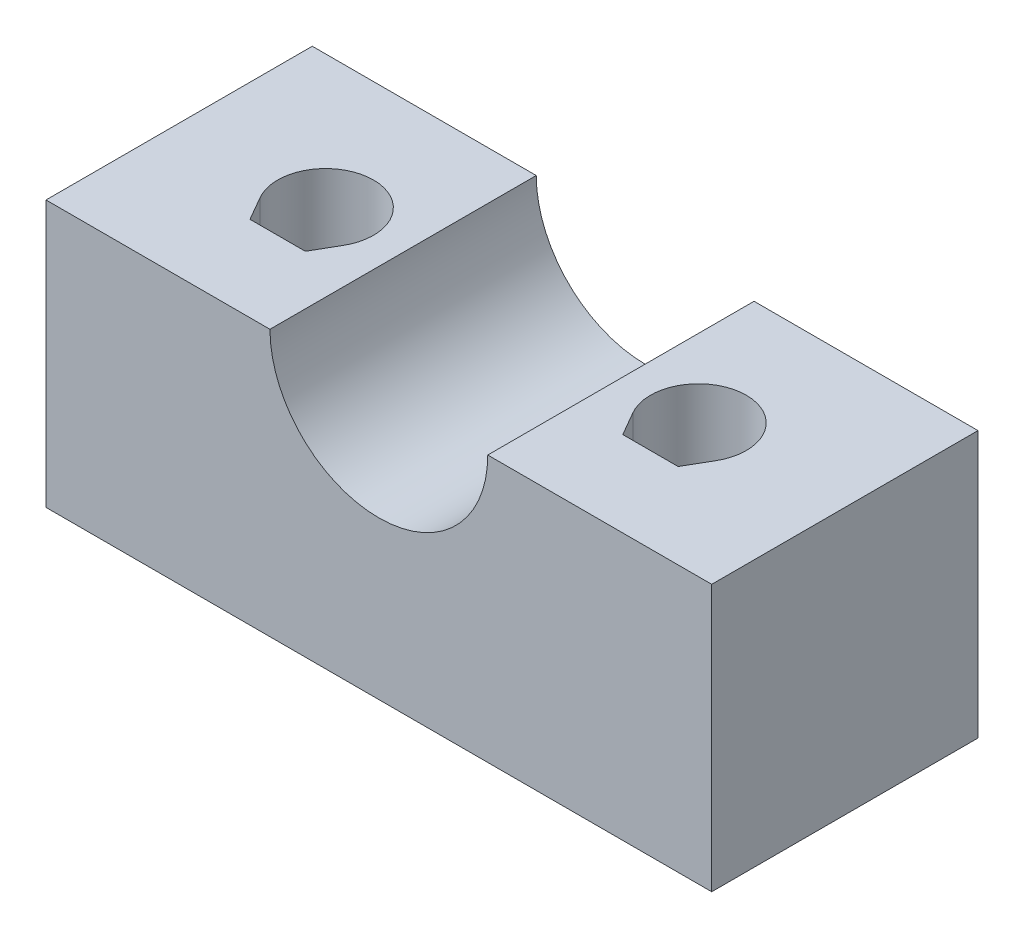
from build123d import *

# Parameters (mm, degrees)
MAIN_BODY_DEPTH   = 5
SCREW_HOLES_REACH = 18.771


with BuildPart() as part:
    # Schizzo1 → Main body (new, symmetric)
    with BuildSketch(Plane.XY):
        with BuildLine():
            Line((-12.5, -5), (12.5, -5))
            Line((12.5, -5), (12.5, 5))
            Line((12.5, 5), (4.09, 5))
            ThreePointArc((4.09, 5), (0, 0.91), (-4.09, 5))
            Line((-4.09, 5), (-12.5, 5))
            Line((-12.5, 5), (-12.5, -5))
        make_face()
    extrude(amount=MAIN_BODY_DEPTH, both=True)

    # Schizzo2 → screw holes (cut, up to next)
    with BuildSketch(Plane.XZ.offset(5), mode=Mode.PRIVATE) as screw_holes_sk1:
        with BuildLine():
            Line((-5.960769515, 1.8), (-5.441154273, 0.9))
            ThreePointArc((-5.441154273, 0.9), (-7, -1.8), (-8.558845727, 0.9))
            Line((-8.558845727, 0.9), (-8.039230485, 1.8))
            Line((-8.039230485, 1.8), (-5.960769515, 1.8))
        make_face()
    screw_holes_tool1 = extrude(screw_holes_sk1.sketch, amount=-SCREW_HOLES_REACH, mode=Mode.PRIVATE) & part.part
    # Schizzo2 → screw holes (cut, up to next)
    with BuildSketch(Plane.XZ.offset(5), mode=Mode.PRIVATE) as screw_holes_sk2:
        with BuildLine():
            Line((5.960769515, 1.8), (8.039230485, 1.8))
            Line((8.039230485, 1.8), (8.558845727, 0.9))
            ThreePointArc((8.558845727, 0.9), (7, -1.8), (5.441154273, 0.9))
            Line((5.441154273, 0.9), (5.960769515, 1.8))
        make_face()
    screw_holes_tool2 = extrude(screw_holes_sk2.sketch, amount=-SCREW_HOLES_REACH, mode=Mode.PRIVATE) & part.part
    add(screw_holes_tool1.solids().sort_by_distance((-7, -5, 0.053309))[0], mode=Mode.SUBTRACT)
    add(screw_holes_tool2.solids().sort_by_distance((7, -5, 0.053309))[0], mode=Mode.SUBTRACT)


solid = part.part
